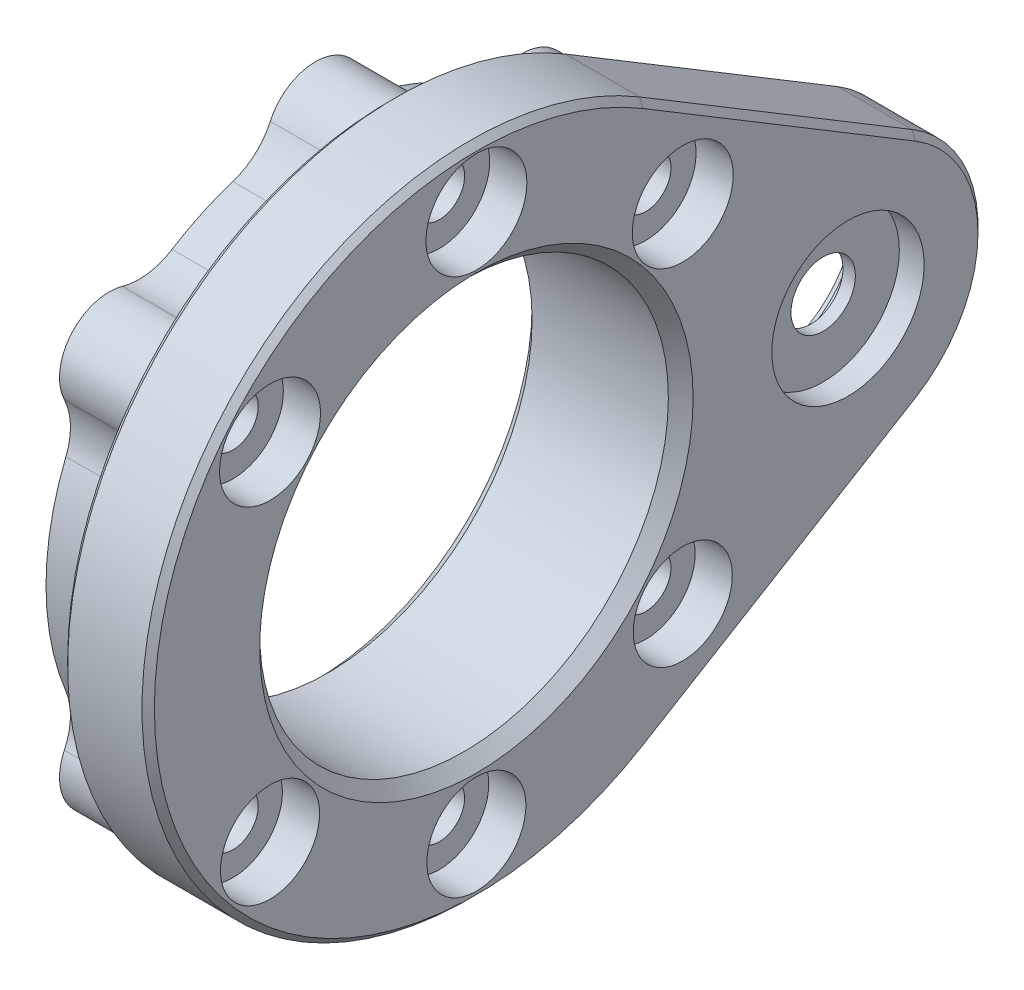
from build123d import *

# Parameters (mm, degrees)
SKETCH_1_R               = 26.5
SKETCH_1_R_2             = 16.5
EXTRUDE_1_DEPTH          = 6
SKETCH_2_R               = 2.05
CUT_EXTRUDE_1_DEPTH      = 10
PATTERN_CIRCULAR_1_COUNT = 3
PATTERN_CIRCULAR_1_ANGLE = 100
SKETCH_3_R               = 2.05
SKETCH_3_R_2             = 2.6
SKETCH_3_R_3             = 16.5
EXTRUDE_2_DEPTH          = 7
CUT_EXTRUDE_START        = -6
CUT_EXTRUDE_2_OUTLINE_R  = 26.5
CUT_EXTRUDE_2_DEPTH      = 6
CHAMFER_1_SIZE           = 1
FILLET_1_R               = 5
SKETCH_5_R               = 4.075
SKETCH_5_R_2             = 4
CUT_EXTRUDE_3_DEPTH      = 3
PATTERN_CIRCULAR_2_COUNT = 2
PATTERN_CIRCULAR_2_ANGLE = 50
F_2_THE_OTHER_WAY_COUNT  = 2
F_2_THE_OTHER_WAY_ANGLE  = 50
SKETCH_6_R               = 6.6
CUT_EXTRUDE_4_DEPTH      = 4
SKETCH_7_R               = 7.6
CUT_EXTRUDE_5_DEPTH      = 1
SKETCH_8_R               = 6.15
CUT_EXTRUDE_6_DEPTH      = 2
CHAMFER_2_SIZE           = 0.5


# Read off the part's stored shape, not the designer's step: 切除-拉伸2
with BuildPart() as part:
    # 草图1 → 凸台-拉伸1 (new body)
    with BuildSketch(Plane(origin=(0, 0, 0), x_dir=(0, 0, -1), z_dir=(1, 0, 0))):
        Circle(SKETCH_1_R)
        Circle(SKETCH_1_R_2, mode=Mode.SUBTRACT)
    extrude(amount=EXTRUDE_1_DEPTH)

    # 草图2 → 切除-拉伸1 (cut)
    with BuildSketch(Plane.ZY):
        with Locations((16.661466638, 13.980630511)):
            Circle(SKETCH_2_R)
        with Locations((-16.661466638, -13.980630511)):
            Circle(SKETCH_2_R)
    cut_extrude_1 = extrude(amount=-CUT_EXTRUDE_1_DEPTH, mode=Mode.SUBTRACT)

    # 阵列(圆周)1: 切除-拉伸1 ×3 about axis
    pattern_circular_1_axis = Axis((0, 0, 0), (-1, 0, 0))
    for i in range(1, PATTERN_CIRCULAR_1_COUNT):
        add(cut_extrude_1.rotate(pattern_circular_1_axis, i * PATTERN_CIRCULAR_1_ANGLE / (PATTERN_CIRCULAR_1_COUNT - 1)), mode=Mode.SUBTRACT)

    # 草图3 → 凸台-拉伸2 (add)
    with BuildSketch(Plane.ZY.offset(-6)):
        with BuildLine():
            ThreePointArc((-35.683333333, 9.418052995), (-41, 0), (-35.683333333, -9.418052995))
            Line((-35.683333333, -9.418052995), (-13.691666667, -22.688945852))
            ThreePointArc((-13.691666667, -22.688945852), (26.5, 0), (-13.691666667, 22.688945852))
            Line((-13.691666667, 22.688945852), (-35.683333333, 9.418052995))
        make_face()
        with Locations((-16.661466638, -13.980630511)):
            Circle(SKETCH_3_R, mode=Mode.SUBTRACT)
        with Locations(Location((0, -21.75, 0), (0, 0, 50))):
            Circle(SKETCH_3_R, mode=Mode.SUBTRACT)
        with Locations(Location((16.661466638, -13.980630511, 0), (0, 0, 100))):
            Circle(SKETCH_3_R, mode=Mode.SUBTRACT)
        with Locations(Location((-30, 0, 0), (0, 0, 180))):
            Circle(SKETCH_3_R_2, mode=Mode.SUBTRACT)
        with Locations(Location((-16.661466638, 13.980630511, 0), (0, 0, 100))):
            Circle(SKETCH_3_R, mode=Mode.SUBTRACT)
        with Locations(Location((0, 0, 0), (0, 0, 180))):
            Circle(SKETCH_3_R_3, mode=Mode.SUBTRACT)
        with Locations(Location((0, 21.75, 0), (0, 0, 50))):
            Circle(SKETCH_3_R, mode=Mode.SUBTRACT)
        with Locations((16.661466638, 13.980630511)):
            Circle(SKETCH_3_R, mode=Mode.SUBTRACT)
    extrude(amount=-EXTRUDE_2_DEPTH)

    # 切除-拉伸2 outline → 切除-拉伸2 (cut)
    with BuildSketch(Plane.ZY.offset(CUT_EXTRUDE_START)):
        Circle(CUT_EXTRUDE_2_OUTLINE_R)
        with BuildLine():
            ThreePointArc((-18.939960291, -10.693007255), (-21.75, 0), (-18.939960291, 10.693007255))
            ThreePointArc((-18.939960291, 10.693007255), (-19.72564441, 16.551780949), (-13.819446038, 16.795398513))
            ThreePointArc((-13.819446038, 16.795398513), (-9.191947193, 19.712194368), (-3.983053015, 21.382183908))
            ThreePointArc((-3.983053015, 21.382183908), (0, 25.75), (3.983053015, 21.382183908))
            ThreePointArc((3.983053015, 21.382183908), (9.191947193, 19.712194368), (13.819446038, 16.795398513))
            ThreePointArc((13.819446038, 16.795398513), (19.72564441, 16.551780949), (18.939960291, 10.693007255))
            ThreePointArc((18.939960291, 10.693007255), (21.75, 0), (18.939960291, -10.693007255))
            ThreePointArc((18.939960291, -10.693007255), (19.72564441, -16.551780949), (13.819446038, -16.795398513))
            ThreePointArc((13.819446038, -16.795398513), (9.191947193, -19.712194368), (3.983053015, -21.382183908))
            ThreePointArc((3.983053015, -21.382183908), (0, -25.75), (-3.983053015, -21.382183908))
            ThreePointArc((-3.983053015, -21.382183908), (-9.191947193, -19.712194368), (-13.819446038, -16.795398513))
            ThreePointArc((-13.819446038, -16.795398513), (-19.72564441, -16.551780949), (-18.939960291, -10.693007255))
        make_face(mode=Mode.SUBTRACT)
    extrude(amount=CUT_EXTRUDE_2_DEPTH, mode=Mode.SUBTRACT)

    # 倒角1
    chamfer_1_edges = [part.edges().sort_by_distance(p)[0] for p in [
        (13, 0, 16.5),
        (0, 0, 16.5),
    ]]
    chamfer(chamfer_1_edges, length=CHAMFER_1_SIZE)

    # 圆角1
    fillet_1_edges = [part.edges().sort_by_distance(p)[0] for p in [
        (3, 10.693007255, -18.939960291),
        (3, -10.693007255, -18.939960291),
        (3, -16.795398513, -13.819446038),
        (3, -21.382183908, -3.983053015),
        (3, -21.382183908, 3.983053015),
        (3, -16.795398513, 13.819446038),
        (3, -10.693007255, 18.939960291),
        (3, 10.693007255, 18.939960291),
        (3, 16.795398513, 13.819446038),
        (3, 21.382183908, 3.983053015),
        (3, 21.382183908, -3.983053015),
        (3, 16.795398513, -13.819446038),
    ]]
    fillet(fillet_1_edges, radius=FILLET_1_R)

    # 草图5 → 切除-拉伸3 (cut)
    with BuildSketch(Plane(origin=(13, 0, 0), x_dir=(0, 0, -1), z_dir=(1, 0, 0))):
        with Locations((0, 21.75)):
            Circle(SKETCH_5_R)
        with Locations((0, -21.75)):
            Circle(SKETCH_5_R_2)
    cut_extrude_3 = extrude(amount=-CUT_EXTRUDE_3_DEPTH, mode=Mode.SUBTRACT)

    # 阵列(圆周)2: 切除-拉伸3 ×2 about axis
    pattern_circular_2_axis = Axis((0, 0, 0), (-1, 0, 0))
    for i in range(1, PATTERN_CIRCULAR_2_COUNT):
        add(cut_extrude_3.rotate(pattern_circular_2_axis, i * PATTERN_CIRCULAR_2_ANGLE / (PATTERN_CIRCULAR_2_COUNT - 1)), mode=Mode.SUBTRACT)

    # 2 the other way: 切除-拉伸3 ×2 about axis
    f_2_the_other_way_axis = Axis((0, 0, 0), (1, 0, 0))
    for i in range(1, F_2_THE_OTHER_WAY_COUNT):
        add(cut_extrude_3.rotate(f_2_the_other_way_axis, i * F_2_THE_OTHER_WAY_ANGLE / (F_2_THE_OTHER_WAY_COUNT - 1)), mode=Mode.SUBTRACT)

    # 草图6 → 切除-拉伸4 (cut)
    with BuildSketch(Plane.ZY.offset(-6)):
        with Locations((-30, 0)):
            Circle(SKETCH_6_R)
    extrude(amount=-CUT_EXTRUDE_4_DEPTH, mode=Mode.SUBTRACT)

    # 草图7 → 切除-拉伸5 (cut)
    with BuildSketch(Plane.ZY.offset(-6)):
        with Locations((-30, 0)):
            Circle(SKETCH_7_R)
    extrude(amount=-CUT_EXTRUDE_5_DEPTH, mode=Mode.SUBTRACT)

    # 草图8 → 切除-拉伸6 (cut)
    with BuildSketch(Plane(origin=(13, 0, 0), x_dir=(0, 0, -1), z_dir=(1, 0, 0))):
        with Locations((30, 0)):
            Circle(SKETCH_8_R)
    extrude(amount=-CUT_EXTRUDE_6_DEPTH, mode=Mode.SUBTRACT)

    # 倒角2
    chamfer_2_edges = [part.edges().sort_by_distance(p)[0] for p in [
        (6, 16.053499424, -24.6875),
        (6, 0, -41),
        (13, 16.053499424, -24.6875),
        (6, -16.053499424, -24.6875),
        (13, 0, -41),
        (13, 0, 26.5),
        (13, -16.053499424, -24.6875),
        (6, 0, 26.5),
    ]]
    chamfer(chamfer_2_edges, length=CHAMFER_2_SIZE)


solid = part.part
